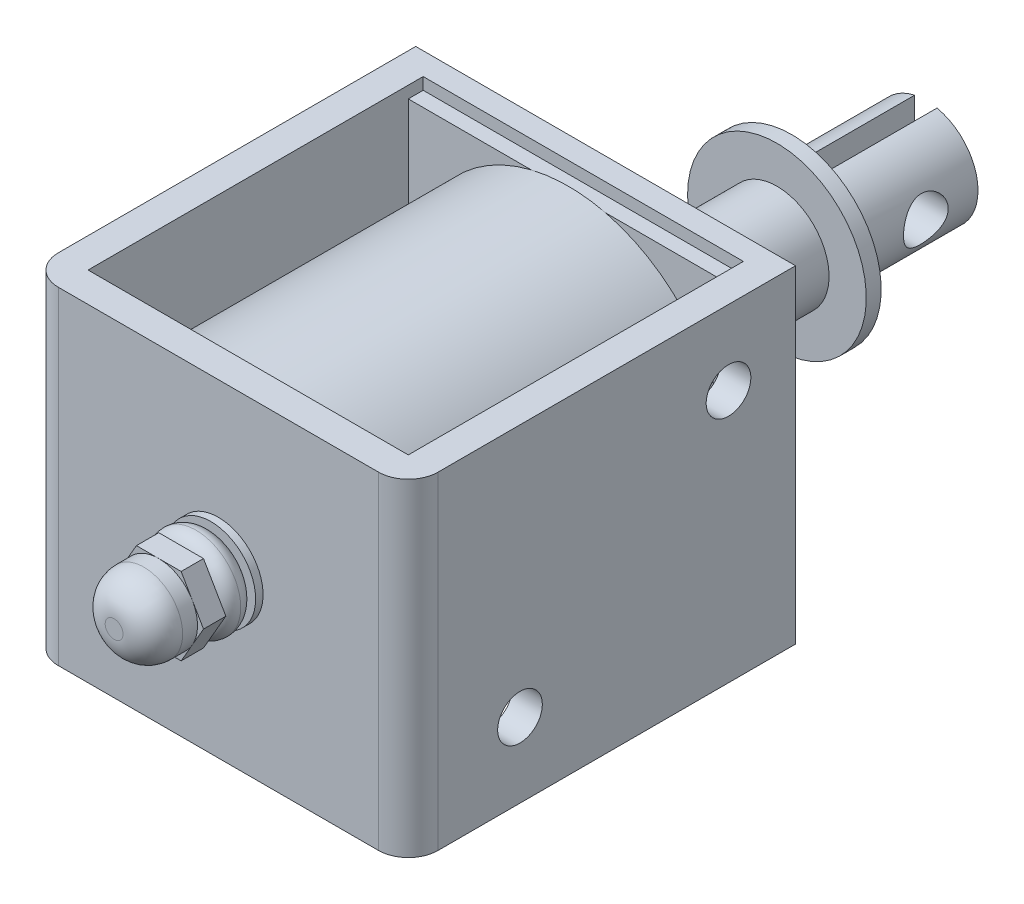
from build123d import *

# Parameters (mm, degrees)
SKETCH2_W               = 25.5
SKETCH2_H               = 26
BOSS_EXTRUDE1_DEPTH     = 22
FILLET1_R               = 2
SKETCH3_W               = 21.5
SKETCH3_H               = 22.5
CUT_EXTRUDE1_DEPTH      = 22
SKETCH4_W               = 21.5
SKETCH4_H               = 20.4
BOSS_EXTRUDE2_DEPTH     = 1
SKETCH5_R               = 10.5
BOSS_EXTRUDE3_DEPTH     = 21.5
SKETCH7_R               = 3
BOSS_EXTRUDE4_DEPTH     = 0.5
SKETCH8_R               = 3
BOSS_EXTRUDE5_DEPTH     = 2
SKETCH7_3_R             = 3
CUT_EXTRUDE2_DEPTH      = 0.5
FILLET2_R               = 1
FILLET3_R               = 1
SKETCH7_4_R             = 3
BOSS_EXTRUDE6_DEPTH     = 0.5
BOSS_EXTRUDE7_DEPTH     = 1.5
SKETCH10_R              = 2.6
BOSS_EXTRUDE8_DEPTH     = 3
FILLET4_R               = 2
SKETCH11_R              = 3.5
BOSS_EXTRUDE9_DEPTH     = 11.5
SKETCH12_R              = 6
BOSS_EXTRUDE10_DEPTH    = 1
SKETCH13_R              = 3.5
BOSS_EXTRUDE11_DEPTH    = 9
SKETCH15_W              = 1.5
SKETCH15_H              = 7
CUT_EXTRUDE3_DEPTH      = 8
CUT_EXTRUDE4_DEPTH      = 5
CUT_EXTRUDE4_DEPTH_BACK = 5
SKETCH16_R              = 1.5
SKETCH17_R              = 5
CUT_EXTRUDE5_DEPTH      = 2
SKETCH18_R              = 5
BOSS_EXTRUDE14_DEPTH    = 2.1
SKETCH19_R              = 1.5
CUT_EXTRUDE6_DEPTH      = 2


with BuildPart() as part:
    # Sketch2 → Boss-Extrude1 (new body)
    with BuildSketch(Plane(origin=(0, 0, 0), x_dir=(1, 0, 0), z_dir=(0, 1, 0))):
        Rectangle(SKETCH2_W, SKETCH2_H)
    extrude(amount=BOSS_EXTRUDE1_DEPTH)

    # Fillet1
    fillet1_edges = [part.edges().sort_by_distance(p)[0] for p in [
        (12.75, 11, 13),
        (-12.75, 11, 13),
    ]]
    fillet(fillet1_edges, radius=FILLET1_R)

    # Sketch3 → Cut-Extrude1 (cut)
    with BuildSketch(Plane(origin=(0, 22, 0), x_dir=(1, 0, 0), z_dir=(0, 1, 0))):
        with Locations((0, 0.25)):
            Rectangle(SKETCH3_W, SKETCH3_H)
    extrude(amount=-CUT_EXTRUDE1_DEPTH, mode=Mode.SUBTRACT)

    # Sketch4 → Boss-Extrude2 (add)
    with BuildSketch(Plane.XY.offset(-11.5)):
        with Locations((0, 11)):
            Rectangle(SKETCH4_W, SKETCH4_H)
    extrude(amount=BOSS_EXTRUDE2_DEPTH)

    # Sketch5 → Boss-Extrude3 (add)
    with BuildSketch(Plane.XY.offset(-10.5)):
        with Locations(Location((0, 11, 0), (0, 0, 256.270867325))):
            Circle(SKETCH5_R)
    extrude(amount=BOSS_EXTRUDE3_DEPTH)

    # Sketch7 → Boss-Extrude4 (add)
    with BuildSketch(Plane.XY.offset(13)):
        with Locations(Location((0, 11, 0), (0, 0, 180))):
            Circle(SKETCH7_R)
    extrude(amount=BOSS_EXTRUDE4_DEPTH)

    # Sketch8 → Boss-Extrude5 (add)
    with BuildSketch(Plane.XY.offset(13.5)):
        with Locations(Location((0, 11, 0), (0, 0, 180))):
            Circle(SKETCH8_R)
    extrude(amount=BOSS_EXTRUDE5_DEPTH)

    # Sketch7<3> → Cut-Extrude2 (cut)
    with BuildSketch(Plane.XY.offset(13)):
        with Locations((0, 11)):
            Circle(SKETCH7_3_R)
    extrude(amount=CUT_EXTRUDE2_DEPTH, mode=Mode.SUBTRACT)


with BuildPart() as cut_extrude2_piece_1:
    # of the separate pieces the step leaves, piece 1, a body of its own (cut_extrude2_pieces)
    add(part.part.solids().sort_by_distance((-10.75, 0, 13))[0])



with BuildPart() as cut_extrude2_piece_2:
    # of the separate pieces the step leaves, piece 2, a body of its own (cut_extrude2_pieces)
    add(part.part.solids().sort_by_distance((-3, 11, 13.5))[0])

    # Fillet2
    fillet2_edges = [cut_extrude2_piece_2.edges().sort_by_distance(p)[0] for p in [
        (3, 11, 13.5),
    ]]
    fillet(fillet2_edges, radius=FILLET2_R)

    # Fillet3
    fillet3_edges = [cut_extrude2_piece_2.edges().sort_by_distance(p)[0] for p in [
        (3, 11, 15.5),
    ]]
    fillet(fillet3_edges, radius=FILLET3_R - 0.0001)  # a hair under: the kernel refuses the full size


with BuildPart() as cut_extrude2_piece_1_1:
    add(cut_extrude2_piece_1.part)

    add(cut_extrude2_piece_2.part)  # Boss-Extrude6 merges Cut-Extrude2 piece 2
    # Sketch7<4> → Boss-Extrude6 (add)
    with BuildSketch(Plane.XY.offset(13)):
        with Locations(Location((0, 11, 0), (0, 0, 180))):
            Circle(SKETCH7_4_R)
    extrude(amount=BOSS_EXTRUDE6_DEPTH)

    # Sketch9 → Boss-Extrude7 (add)
    with BuildSketch(Plane.XY.offset(15.5)):
        Polygon((3.0022214, 11), (1.5011107, 13.6), (-1.5011107, 13.6), (-3.0022214, 11), (-1.5011107, 8.4), (1.5011107, 8.4), align=None)
    extrude(amount=BOSS_EXTRUDE7_DEPTH)

    # Sketch10 → Boss-Extrude8 (add)
    with BuildSketch(Plane.XY.offset(17)):
        with Locations(Location((0, 11, 0), (0, 0, 150))):
            Circle(SKETCH10_R)
    extrude(amount=BOSS_EXTRUDE8_DEPTH)

    # Fillet4
    fillet4_edges = [cut_extrude2_piece_1_1.edges().sort_by_distance(p)[0] for p in [
        (2.25166605, 9.7, 20),
    ]]
    fillet(fillet4_edges, radius=FILLET4_R)

    # Sketch11 → Boss-Extrude9 (add)
    with BuildSketch(Plane(origin=(0, 0, -13), x_dir=(-1, 0, 0), z_dir=(0, 0, -1))):
        with Locations((0, 11)):
            Circle(SKETCH11_R)
    extrude(amount=BOSS_EXTRUDE9_DEPTH)

    # Sketch12 → Boss-Extrude10 (add)
    with BuildSketch(Plane(origin=(0, 0, -24.5), x_dir=(-1, 0, 0), z_dir=(0, 0, -1))):
        with Locations((0, 11)):
            Circle(SKETCH12_R)
    extrude(amount=BOSS_EXTRUDE10_DEPTH)

    # Sketch13 → Boss-Extrude11 (add)
    with BuildSketch(Plane(origin=(0, 0, -25.5), x_dir=(-1, 0, 0), z_dir=(0, 0, -1))):
        with Locations((0, 11)):
            Circle(SKETCH13_R)
    extrude(amount=BOSS_EXTRUDE11_DEPTH)

    # Sketch15 → Cut-Extrude3 (cut)
    with BuildSketch(Plane(origin=(0, 0, -34.5), x_dir=(-1, 0, 0), z_dir=(0, 0, -1))):
        with Locations((0, 11)):
            Rectangle(SKETCH15_W, SKETCH15_H)
    extrude(amount=-CUT_EXTRUDE3_DEPTH, mode=Mode.SUBTRACT)

    # Sketch16 → Cut-Extrude4 (cut, two sides: drawn at the far end of the back side and taken through both)
    with BuildSketch(Plane.ZY.offset(-0.75).offset(-CUT_EXTRUDE4_DEPTH_BACK)):
        with Locations(Location((-31, 10.922268779, 0), (0, 0, 180))):
            Circle(SKETCH16_R)
    extrude(amount=CUT_EXTRUDE4_DEPTH + CUT_EXTRUDE4_DEPTH_BACK, mode=Mode.SUBTRACT)

    # Sketch17 → Cut-Extrude5 (cut)
    with BuildSketch(Plane(origin=(0, 0, -13), x_dir=(-1, 0, 0), z_dir=(0, 0, -1))):
        with Locations((0, 11)):
            Circle(SKETCH17_R)
    extrude(amount=-CUT_EXTRUDE5_DEPTH, mode=Mode.SUBTRACT)


with BuildPart() as cut_extrude5_piece_1:
    # of the separate pieces the step leaves, piece 1, a body of its own (cut_extrude5_pieces)
    add(cut_extrude2_piece_1_1.part.solids().sort_by_distance((12.75, 0, -13))[0])



with BuildPart() as cut_extrude5_piece_2:
    # of the separate pieces the step leaves, piece 2, a body of its own (cut_extrude5_pieces)
    add(cut_extrude2_piece_1_1.part.solids().sort_by_distance((-6, 11, -24.5))[0])


with BuildPart() as cut_extrude5_piece_1_1:
    add(cut_extrude5_piece_1.part)

    add(cut_extrude5_piece_2.part)  # Boss-Extrude14 merges Cut-Extrude5 piece 2
    # Sketch18 → Boss-Extrude14 (add)
    with BuildSketch(Plane(origin=(0, 0, -11), x_dir=(-1, 0, 0), z_dir=(0, 0, -1))):
        with Locations((0, 11)):
            Circle(SKETCH18_R)
    extrude(amount=BOSS_EXTRUDE14_DEPTH)

    # Sketch19 → Cut-Extrude6 (cut)
    with BuildSketch(Plane(origin=(12.75, 0, 0), x_dir=(0, 0, -1), z_dir=(1, 0, 0))):
        with Locations((-5.5, 5)):
            Circle(SKETCH19_R)
        with Locations((8.5, 17)):
            Circle(SKETCH19_R)
    extrude(amount=-CUT_EXTRUDE6_DEPTH, mode=Mode.SUBTRACT)


solid = cut_extrude5_piece_1_1.part
